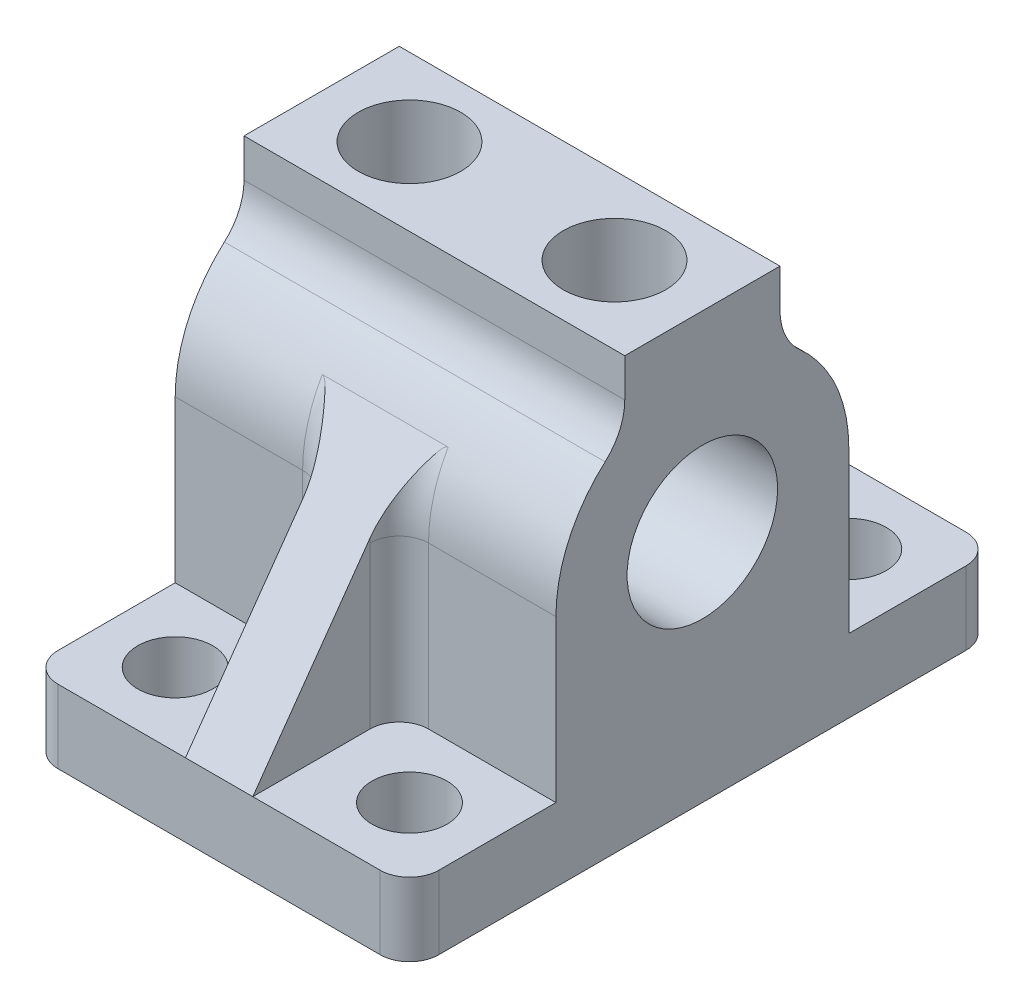
from build123d import *

# Parameters (mm, degrees)
SKETCH1_R           = 3.2639
BOSS_EXTRUDE1_DEPTH = 8.255
BOSS_EXTRUDE2_DEPTH = 1.4605
SKETCH3_R           = 1.6256
CUT_EXTRUDE1_DEPTH  = 21.180615699
CUT_EXTRUDE2_DEPTH  = 42.211451079
SKETCH6_W           = 16.51
SKETCH6_H           = 6.731
BOSS_EXTRUDE3_DEPTH = 2.921
SKETCH5_R           = 2.2225
CUT_EXTRUDE3_DEPTH  = 6.35
FILLET1_R           = 1.27
FILLET2_R           = 2.54


with BuildPart() as part:
    # Sketch1 → Boss-Extrude1 (new, symmetric)
    with BuildSketch(Plane(origin=(0, 0, 0), x_dir=(0, 0, -1), z_dir=(1, 0, 0))):
        with BuildLine():
            Line((12.7, 19.05), (-12.7, 19.05))
            Line((-12.7, 19.05), (-12.7, 22.225))
            Line((-12.7, 22.225), (-6.35, 22.225))
            Line((-6.35, 22.225), (-6.35, 29.21))
            ThreePointArc((-6.35, 29.21), (0, 35.56), (6.35, 29.21))
            Line((6.35, 29.21), (6.35, 22.225))
            Line((6.35, 22.225), (12.7, 22.225))
            Line((12.7, 22.225), (12.7, 19.05))
        make_face()
        with Locations((0, 29.21)):
            Circle(SKETCH1_R, mode=Mode.SUBTRACT)
    extrude(amount=BOSS_EXTRUDE1_DEPTH, both=True)

    # Sketch2 → Boss-Extrude2 (add, symmetric)
    with BuildSketch(Plane(origin=(0, 0, 0), x_dir=(0, 0, -1), z_dir=(1, 0, 0))):
        Polygon((-5.499261314, 32.385), (-12.7, 22.225), (-5.499261314, 22.225), align=None)
        Polygon((5.499261314, 22.225), (5.499261314, 32.385), (12.7, 22.225), align=None)
    extrude(amount=BOSS_EXTRUDE2_DEPTH, both=True)

    # Sketch3 → Cut-Extrude1 (cut, through all)
    with BuildSketch(Plane(origin=(0, 22.225, 0), x_dir=(1, 0, 0), z_dir=(0, 1, 0))):
        with Locations((-5.08, 9.525)):
            Circle(SKETCH3_R)
        with Locations((5.08, 9.525)):
            Circle(SKETCH3_R)
        with Locations((5.08, -9.525)):
            Circle(SKETCH3_R)
        with Locations((-5.08, -9.525)):
            Circle(SKETCH3_R)
    extrude(amount=-CUT_EXTRUDE1_DEPTH, mode=Mode.SUBTRACT)

    # Sketch4 → Cut-Extrude2 (cut, through all)
    with BuildSketch(Plane(origin=(8.255, 0, 0), x_dir=(0, 0, -1), z_dir=(1, 0, 0))):
        with BuildLine():
            Line((3.3655, 34.594785024), (-3.3655, 34.594785024))
            ThreePointArc((-3.3655, 34.594785024), (0, 35.56), (3.3655, 34.594785024))
        make_face()
    extrude(amount=-CUT_EXTRUDE2_DEPTH, mode=Mode.SUBTRACT)

    # Sketch6 → Boss-Extrude3 (add)
    with BuildSketch(Plane(origin=(0, 34.594785024, 0), x_dir=(1, 0, 0), z_dir=(0, 1, 0))):
        Rectangle(SKETCH6_W, SKETCH6_H)
    extrude(amount=BOSS_EXTRUDE3_DEPTH)

    # Sketch5 → Cut-Extrude3 (cut)
    with BuildSketch(Plane(origin=(0, 37.515785024, 0), x_dir=(1, 0, 0), z_dir=(0, 1, 0))):
        with Locations((-4.445, 0)):
            Circle(SKETCH5_R)
        with Locations((4.445, 0)):
            Circle(SKETCH5_R)
    extrude(amount=-CUT_EXTRUDE3_DEPTH, mode=Mode.SUBTRACT)

    # Fillet1
    fillet1_edges = [part.edges().sort_by_distance(p)[0] for p in [
        (-1.4605, 30.853500936, 6.133628997),
        (1.4605, 30.853500936, 6.133628997),
        (-1.4605, 30.853500936, -6.133628997),
        (1.4605, 30.853500936, -6.133628997),
        (-1.4605, 25.7175, 6.35),
        (1.4605, 25.7175, 6.35),
        (-1.4605, 25.7175, -6.35),
        (1.4605, 25.7175, -6.35),
        (-8.255, 20.6375, -12.7),
        (8.255, 20.6375, -12.7),
        (-8.255, 20.6375, 12.7),
        (8.255, 20.6375, 12.7),
    ]]
    fillet(fillet1_edges, radius=FILLET1_R)

    # Fillet2
    fillet2_edges = [part.edges().sort_by_distance(p)[0] for p in [
        (0, 34.594785024, -3.3655),
        (0, 34.594785024, 3.3655),
    ]]
    fillet(fillet2_edges, radius=FILLET2_R)


solid = part.part
